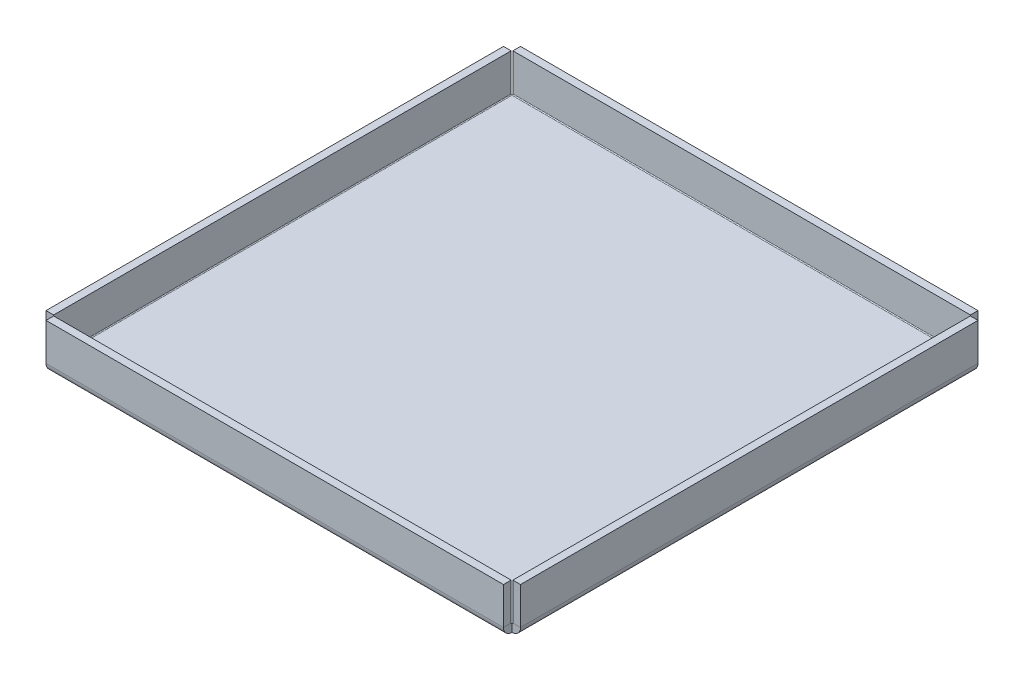
from build123d import *

# Parameters (mm, degrees)
SKETCH1_W          = 381
SKETCH1_H          = 381
BASE_FLANGE1_DEPTH = 6.35
EDGE_FLANGE3_DEPTH = 381
EDGE_FLANGE4_DEPTH = 381
EDGE_FLANGE5_DEPTH = 381
EDGE_FLANGE6_DEPTH = 381


# Sheet-metal steps are written as plain solids
with BuildPart() as part:
    # Sketch1 → Base-Flange1 (new body)
    with BuildSketch(Plane(origin=(0, 0, 0), x_dir=(1, 0, 0), z_dir=(0, 1, 0))):
        with Locations((190.5, 190.5)):
            Rectangle(SKETCH1_W, SKETCH1_H)
    extrude(amount=-BASE_FLANGE1_DEPTH)

    # Edge-Flange3 section (across the edge) → Edge-Flange3 (add)
    with BuildSketch(Plane(origin=(-0.7366, 0, -381), x_dir=(1, 0, 0), z_dir=(0, 0, 1))):
        with BuildLine():
            Line((-6.35, 0.7366), (-6.35, 31.75))
            Line((-6.35, 31.75), (0, 31.75))
            Line((0, 31.75), (0, 0.7366))
            ThreePointArc((0, 0.7366), (0.215745145, 0.215745145), (0.7366, 0))
            Line((0.7366, 0), (0.7366, -6.35))
            ThreePointArc((0.7366, -6.35), (-4.274382916, -4.274382916), (-6.35, 0.7366))
        make_face()
    extrude(amount=EDGE_FLANGE3_DEPTH)

    # Edge-Flange4 section (across the edge) → Edge-Flange4 (add)
    with BuildSketch(Plane(origin=(381, 0, -381.7366), x_dir=(0, 0, 1), z_dir=(-1, 0, 0))):
        with BuildLine():
            Line((-6.35, 0.7366), (-6.35, 31.75))
            Line((-6.35, 31.75), (0, 31.75))
            Line((0, 31.75), (0, 0.7366))
            ThreePointArc((0, 0.7366), (0.215745145, 0.215745145), (0.7366, 0))
            Line((0.7366, 0), (0.7366, -6.35))
            ThreePointArc((0.7366, -6.35), (-4.274382916, -4.274382916), (-6.35, 0.7366))
        make_face()
    extrude(amount=EDGE_FLANGE4_DEPTH)

    # Edge-Flange5 section (across the edge) → Edge-Flange5 (add)
    with BuildSketch(Plane(origin=(0, 0, 0.7366), x_dir=(0, 0, -1), z_dir=(1, 0, 0))):
        with BuildLine():
            Line((-6.35, 0.7366), (-6.35, 31.75))
            Line((-6.35, 31.75), (0, 31.75))
            Line((0, 31.75), (0, 0.7366))
            ThreePointArc((0, 0.7366), (0.215745145, 0.215745145), (0.7366, 0))
            Line((0.7366, 0), (0.7366, -6.35))
            ThreePointArc((0.7366, -6.35), (-4.274382916, -4.274382916), (-6.35, 0.7366))
        make_face()
    extrude(amount=EDGE_FLANGE5_DEPTH)

    # Edge-Flange6 section (across the edge) → Edge-Flange6 (add)
    with BuildSketch(Plane(origin=(381.7366, 0, 0), x_dir=(-1, 0, 0), z_dir=(0, 0, -1))):
        with BuildLine():
            Line((-6.35, 0.7366), (-6.35, 31.75))
            Line((-6.35, 31.75), (0, 31.75))
            Line((0, 31.75), (0, 0.7366))
            ThreePointArc((0, 0.7366), (0.215745145, 0.215745145), (0.7366, 0))
            Line((0.7366, 0), (0.7366, -6.35))
            ThreePointArc((0.7366, -6.35), (-4.274382916, -4.274382916), (-6.35, 0.7366))
        make_face()
    extrude(amount=EDGE_FLANGE6_DEPTH)


solid = part.part
